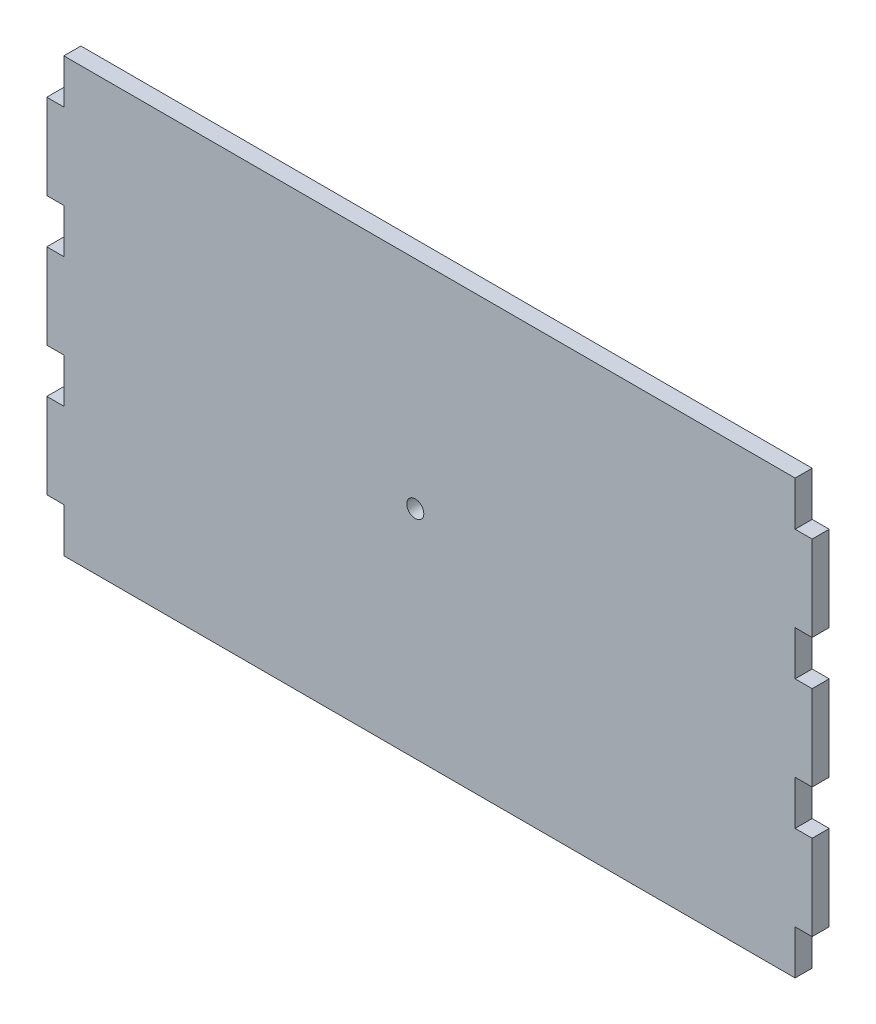
from build123d import *

# Parameters (mm, degrees)
SKETCH1_W                       = 134.7
SKETCH1_H                       = 76.2
BOSS_EXTRUDE1_DEPTH             = 3
SKETCH2_W                       = 3
SKETCH2_H                       = 7.8
CUT_EXTRUDE1_DEPTH              = 78.437926754
LPATTERN1_COUNT                 = 4
LPATTERN1_PITCH                 = 22.8
F_3_0MM_CLEARANCE_DOWEL_HOLE1_D = 3
MIRROR4_COPY_1_SKETCH_W         = 3
MIRROR4_COPY_1_SKETCH_H         = 7.8
MIRROR4_COPY_1_DEPTH            = 78.437926754
MIRROR4_COPY_2_SKETCH_W         = 3
MIRROR4_COPY_2_SKETCH_H         = 7.8
MIRROR4_COPY_2_DEPTH            = 78.437926754
MIRROR4_COPY_3_SKETCH_W         = 3
MIRROR4_COPY_3_SKETCH_H         = 7.8
MIRROR4_COPY_3_DEPTH            = 78.437926754
MIRROR4_COPY_4_SKETCH_W         = 3
MIRROR4_COPY_4_SKETCH_H         = 7.8
MIRROR4_COPY_4_DEPTH            = 78.437926754


with BuildPart() as part:
    # Sketch1 → Boss-Extrude1 (new body)
    with BuildSketch(Plane.XY):
        Rectangle(SKETCH1_W, SKETCH1_H)
    extrude(amount=BOSS_EXTRUDE1_DEPTH)

    # Sketch2 → Cut-Extrude1 (cut, through all)
    with BuildSketch(Plane.XY.offset(3)):
        with Locations((-65.85, 34.2)):
            Rectangle(SKETCH2_W, SKETCH2_H)
    cut_extrude1 = extrude(amount=-CUT_EXTRUDE1_DEPTH, mode=Mode.SUBTRACT)

    # LPattern1: Cut-Extrude1 ×4
    with Locations(*[(0, -i * LPATTERN1_PITCH, 0) for i in range(1, LPATTERN1_COUNT)]):
        add(cut_extrude1, mode=Mode.SUBTRACT)

    # Ø3.0mm Clearance Dowel Hole1 (through all)
    with Locations(Plane.XY.offset(3)):
        with Locations((-2.5, 0)):
            Hole(F_3_0MM_CLEARANCE_DOWEL_HOLE1_D / 2)

    # Mirror4 copy 1 sketch → Mirror4 copy 1 (cut, through all)
    with BuildSketch(Plane(origin=(0, -22.8, 3), x_dir=(-1, 0, 0), z_dir=(0, 0, 1))):
        with Locations((-65.85, -34.2)):
            Rectangle(MIRROR4_COPY_1_SKETCH_W, MIRROR4_COPY_1_SKETCH_H)
    extrude(amount=-MIRROR4_COPY_1_DEPTH, mode=Mode.SUBTRACT)

    # Mirror4 copy 2 sketch → Mirror4 copy 2 (cut, through all)
    with BuildSketch(Plane(origin=(0, -45.6, 3), x_dir=(-1, 0, 0), z_dir=(0, 0, 1))):
        with Locations((-65.85, -34.2)):
            Rectangle(MIRROR4_COPY_2_SKETCH_W, MIRROR4_COPY_2_SKETCH_H)
    extrude(amount=-MIRROR4_COPY_2_DEPTH, mode=Mode.SUBTRACT)

    # Mirror4 copy 3 sketch → Mirror4 copy 3 (cut, through all)
    with BuildSketch(Plane(origin=(0, -68.4, 3), x_dir=(-1, 0, 0), z_dir=(0, 0, 1))):
        with Locations((-65.85, -34.2)):
            Rectangle(MIRROR4_COPY_3_SKETCH_W, MIRROR4_COPY_3_SKETCH_H)
    extrude(amount=-MIRROR4_COPY_3_DEPTH, mode=Mode.SUBTRACT)

    # Mirror4 copy 4 sketch → Mirror4 copy 4 (cut, through all)
    with BuildSketch(Plane(origin=(0, 0, 3), x_dir=(-1, 0, 0), z_dir=(0, 0, 1))):
        with Locations((-65.85, -34.2)):
            Rectangle(MIRROR4_COPY_4_SKETCH_W, MIRROR4_COPY_4_SKETCH_H)
    extrude(amount=-MIRROR4_COPY_4_DEPTH, mode=Mode.SUBTRACT)


solid = part.part
